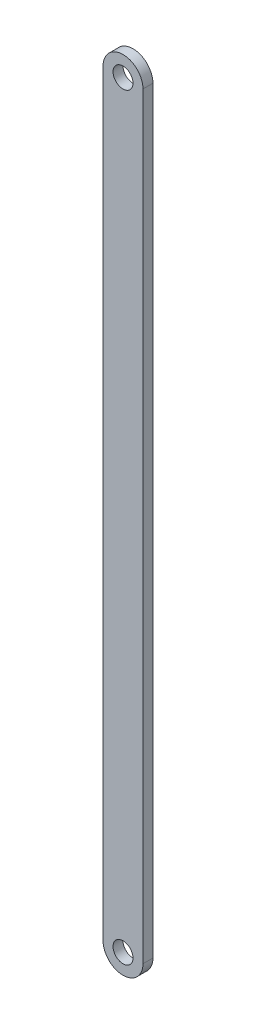
from build123d import *

# Parameters (mm, degrees)
SKETCH1_R           = 6.35
BOSS_EXTRUDE1_DEPTH = 6.35


with BuildPart() as part:
    # Sketch1 → Boss-Extrude1 (new body)
    with BuildSketch(Plane.XY):
        with BuildLine():
            Line((12.7, -241.3), (12.7, 241.3))
            ThreePointArc((12.7, 241.3), (0, 254), (-12.7, 241.3))
            Line((-12.7, 241.3), (-12.7, -241.3))
            ThreePointArc((-12.7, -241.3), (0, -254), (12.7, -241.3))
        make_face()
        with Locations((0, 241.3)):
            Circle(SKETCH1_R, mode=Mode.SUBTRACT)
        with Locations((0, -241.3)):
            Circle(SKETCH1_R, mode=Mode.SUBTRACT)
    extrude(amount=BOSS_EXTRUDE1_DEPTH)


solid = part.part
